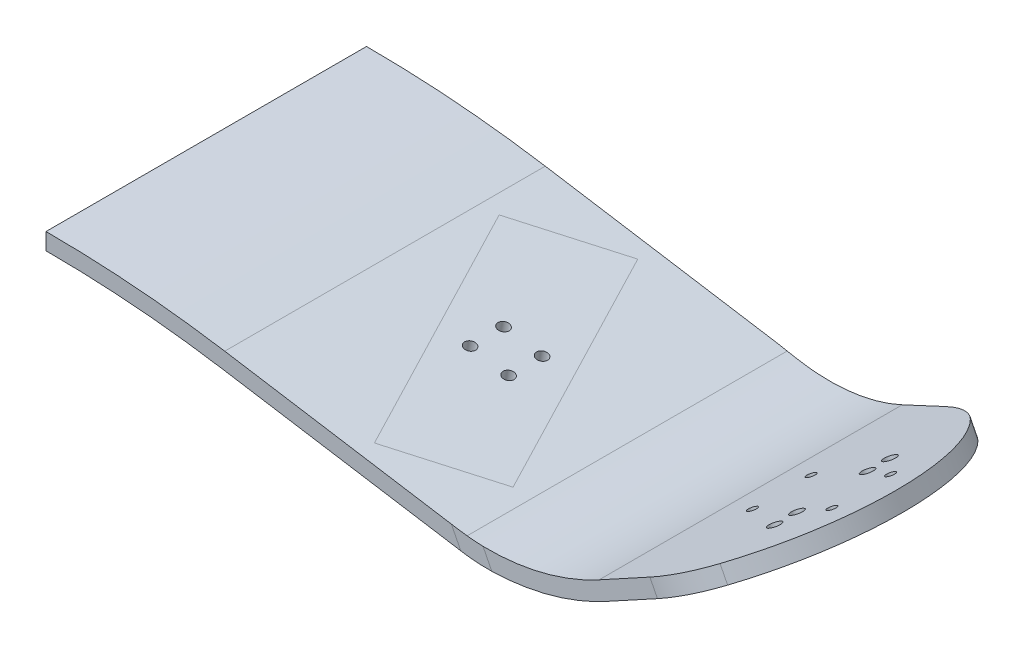
from build123d import *

# Parameters (mm, degrees)
EXTRUDE_THIN1_DEPTH  = 115
CUT_EXTRUDE1_DEPTH   = 620.892995583
FILLET1_R            = 250
SKETCH3_R            = 4
BINDING_HOLES_DEPTH  = 527.107084161
SKETCH4_R            = 4
CUT_EXTRUDE2_DEPTH   = 947.891927405
M6_CLEARANCE_HOLE1_D = 6.6
M8_CLEARANCE_HOLE1_D = 9
SKETCH9_W            = 500
SKETCH9_H            = 230
CUT_EXTRUDE3_DEPTH   = 520.361349661


with BuildPart() as part:
    # Sketch1 → Extrude-Thin1 (new, symmetric)
    with BuildSketch(Plane.XY):
        with BuildLine():
            Line((-500, 70), (-396.134492808, 17.077880761))
            ThreePointArc((-396.134492808, 17.077880761), (-349.336150967, 1.90144375), (-300.138569045, 1.984944587))
            Line((-300.138569045, 1.984944587), (-126.368172253, 29.91072477))
            ThreePointArc((-126.368172253, 29.91072477), (0, 40), (126.368172253, 29.91072477))
            Line((126.368172253, 29.91072477), (300.138569045, 1.984944587))
            ThreePointArc((300.138569045, 1.984944587), (349.336150967, 1.90144375), (396.134492808, 17.077880761))
            Line((396.134492808, 17.077880761), (500, 70))
            Line((500, 70), (494.552114003, 80.69207829))
            Line((494.552114003, 80.69207829), (390.686606812, 27.769959051))
            ThreePointArc((390.686606812, 27.769959051), (347.472349444, 13.755820321), (302.042599512, 13.832926187))
            Line((302.042599512, 13.832926187), (128.27220272, 41.75870637))
            ThreePointArc((128.27220272, 41.75870637), (0, 52), (-128.27220272, 41.75870637))
            Line((-128.27220272, 41.75870637), (-302.042599512, 13.832926187))
            ThreePointArc((-302.042599512, 13.832926187), (-347.472349444, 13.755820321), (-390.686606812, 27.769959051))
            Line((-390.686606812, 27.769959051), (-494.552114003, 80.69207829))
            Line((-494.552114003, 80.69207829), (-500, 70))
        make_face()
    extrude(amount=EXTRUDE_THIN1_DEPTH, both=True)

    # Sketch2 → Cut-Extrude1 (cut, symmetric)
    with BuildSketch(Plane(origin=(-69.290206127, -135.989686473, 0), x_dir=(-0.8910065241883677, 0.4539904997395473, 0), z_dir=(0.45399049973954725, 0.8910065241883676, 0))):
        with BuildLine():
            Line((-1243.954382633, 226.09395148), (275.40194382, 115))
            Line((275.40194382, 115), (398.488815391, 106))
            ThreePointArc((398.488815391, 106), (418.996120575, 101.069384919), (436.845066451, 89.8321405))
            ThreePointArc((436.845066451, 89.8321405), (477.282597076, 0), (436.845066451, -89.8321405))
            ThreePointArc((436.845066451, -89.8321405), (418.996120575, -101.069384919), (398.488815391, -106))
            Line((398.488815391, -106), (275.40194382, -115))
            Line((275.40194382, -115), (-1243.954382633, -226.09395148))
            Line((-1243.954382633, -226.09395148), (1802.870530478, -226.09395148))
            Line((1802.870530478, -226.09395148), (1802.870530478, 226.09395148))
            Line((1802.870530478, 226.09395148), (-1243.954382633, 226.09395148))
        make_face()
    cut_extrude1 = extrude(amount=CUT_EXTRUDE1_DEPTH, both=True, mode=Mode.SUBTRACT)

    # Mirror1: Cut-Extrude1 across plane
    add(cut_extrude1.mirror(Plane(origin=(0, 0, 0), x_dir=(0, 0, 1), z_dir=(1, 0, 0))), mode=Mode.SUBTRACT)

    # Fillet1
    # the kernel refuses this fillet: 250 mm, written as the material it takes off along each edge
    with BuildSketch(Plane(origin=(-319.014996724, -19.477278886, 115), x_dir=(-0.8886341933277065, 0.4527817367914195, -0.07292440796442752), z_dir=(0.45399049973954736, 0.8910065241883677, 0))) as fillet1_piece_1:
        with BuildLine():
            CenterArc((FILLET1_R * 0.0365108095299, -FILLET1_R), FILLET1_R, 90, 4.181973001)
            Line((-FILLET1_R * 0.0364135984345, -FILLET1_R * 0.00266252916927), (-FILLET1_R * 0.0378720865938, FILLET1_R * 0.0172842202473))
            Line((-FILLET1_R * 0.0378720865938, FILLET1_R * 0.0172842202473), (-FILLET1_R * 0.000730216190598, FILLET1_R * 0.02))
            Line((-FILLET1_R * 0.000730216190598, FILLET1_R * 0.02), (FILLET1_R * 0.0365108095299, FILLET1_R * 0.02))
            Line((FILLET1_R * 0.0365108095299, FILLET1_R * 0.02), (FILLET1_R * 0.0365108095299, 0))
        make_face()
    extrude(amount=60.204173091, mode=Mode.SUBTRACT)
    # the kernel refuses this fillet: 250 mm, written as the material it takes off along each edge
    with BuildSketch(Plane(origin=(319.014996724, -19.477278886, 115), x_dir=(-0.8910065241883677, -0.4539904997395473, 0), z_dir=(-0.45399049973954736, 0.8910065241883677, 0))) as fillet1_2_piece_1:
        with BuildLine():
            CenterArc((FILLET1_R * 0.0365108095299, -FILLET1_R), FILLET1_R, 90, 4.181973001)
            Line((-FILLET1_R * 0.0364135984345, -FILLET1_R * 0.00266252916927), (-FILLET1_R * 0.0378720865938, FILLET1_R * 0.0172842202473))
            Line((-FILLET1_R * 0.0378720865938, FILLET1_R * 0.0172842202473), (-FILLET1_R * 0.000730216190598, FILLET1_R * 0.02))
            Line((-FILLET1_R * 0.000730216190598, FILLET1_R * 0.02), (FILLET1_R * 0.0365108095299, FILLET1_R * 0.02))
            Line((FILLET1_R * 0.0365108095299, FILLET1_R * 0.02), (FILLET1_R * 0.0365108095299, 0))
        make_face()
    extrude(amount=60.204173091, mode=Mode.SUBTRACT)
    # the kernel refuses this fillet: 250 mm, written as the material it takes off along each edge
    with BuildSketch(Plane(origin=(-319.014996724, -19.477278886, -115), x_dir=(0.8910065241883677, -0.4539904997395473, 0), z_dir=(0.4539904997395473, 0.8910065241883677, 0))) as fillet1_3_piece_1:
        with BuildLine():
            CenterArc((FILLET1_R * 0.0365108095299, -FILLET1_R), FILLET1_R, 90, 4.181973001)
            Line((-FILLET1_R * 0.0364135984345, -FILLET1_R * 0.00266252916927), (-FILLET1_R * 0.0378720865938, FILLET1_R * 0.0172842202473))
            Line((-FILLET1_R * 0.0378720865938, FILLET1_R * 0.0172842202473), (-FILLET1_R * 0.000730216190598, FILLET1_R * 0.02))
            Line((-FILLET1_R * 0.000730216190598, FILLET1_R * 0.02), (FILLET1_R * 0.0365108095299, FILLET1_R * 0.02))
            Line((FILLET1_R * 0.0365108095299, FILLET1_R * 0.02), (FILLET1_R * 0.0365108095299, 0))
        make_face()
    extrude(amount=60.204173091, mode=Mode.SUBTRACT)
    # the kernel refuses this fillet: 250 mm, written as the material it takes off along each edge
    with BuildSketch(Plane(origin=(319.014996724, -19.477278886, -115), x_dir=(-0.8910065241883677, -0.4539904997395473, 0), z_dir=(-0.4539904997395473, 0.8910065241883677, 0))) as fillet1_4_piece_1:
        with BuildLine():
            CenterArc((FILLET1_R * 0.0365108095299, FILLET1_R), FILLET1_R, 265.818026999, 4.181973001)
            Line((-FILLET1_R * 0.0364135984345, FILLET1_R * 0.00266252916927), (-FILLET1_R * 0.0378720865938, -FILLET1_R * 0.0172842202473))
            Line((-FILLET1_R * 0.0378720865938, -FILLET1_R * 0.0172842202473), (-FILLET1_R * 0.000730216190598, -FILLET1_R * 0.02))
            Line((-FILLET1_R * 0.000730216190598, -FILLET1_R * 0.02), (FILLET1_R * 0.0365108095299, -FILLET1_R * 0.02))
            Line((FILLET1_R * 0.0365108095299, -FILLET1_R * 0.02), (FILLET1_R * 0.0365108095299, 0))
        make_face()
    extrude(amount=60.204173091, mode=Mode.SUBTRACT)

    # Sketch3 → Binding Holes (cut, through all)
    with BuildSketch(Plane(origin=(-9.771253847, 60.8024072, 0), x_dir=(-0.9873317999532861, -0.15866920558509276, 0), z_dir=(-0.15866920558509276, 0.9873317999532861, 0))):
        with Locations((222.02140403, 12)):
            Circle(SKETCH3_R)
        with Locations(Location((222.02140403, -12, 0), (0, 0, 180))):
            Circle(SKETCH3_R)
        with Locations((194.02140403, -12)):
            Circle(SKETCH3_R)
        with Locations(Location((194.02140403, 12, 0), (0, 0, 180))):
            Circle(SKETCH3_R)
    extrude(amount=-BINDING_HOLES_DEPTH, mode=Mode.SUBTRACT)

    # Sketch4 → Cut-Extrude2 (cut, through all)
    with BuildSketch(Plane(origin=(430.771006706, -6.854378838, -35.350500744), x_dir=(-0.9873317999532861, 0.15866920558509276, 0), z_dir=(0.15866920558509276, 0.9873317999532861, 0))):
        with Locations((232.380088234, 47.350500744)):
            Circle(SKETCH4_R)
        with Locations(Location((232.380088234, 23.350500744, 0), (0, 0, 180))):
            Circle(SKETCH4_R)
        with Locations((204.380088234, 23.350500744)):
            Circle(SKETCH4_R)
        with Locations(Location((204.380088234, 47.350500744, 0), (0, 0, 180))):
            Circle(SKETCH4_R)
    extrude(amount=-CUT_EXTRUDE2_DEPTH, mode=Mode.SUBTRACT)

    # M6 Clearance Hole1 (through all)
    with Locations(Plane(origin=(-49.331097603, -146.159360215, -63.345400331), x_dir=(-0.8910065241883677, 0.4539904997395473, 0), z_dir=(0.45399049973954725, 0.8910065241883676, 0))):
        with Locations((472.112244346, 84.345400331), (408.112244346, 84.345400331), (408.112244346, 42.345400331), (472.112244346, 42.345400331)):
            m6_clearance_hole1 = Hole(M6_CLEARANCE_HOLE1_D / 2)

    # M8 Clearance Hole1 (through all)
    with Locations(Plane(origin=(-70.616279149, -135.31401852, -54.210944478), x_dir=(-0.8910065241883677, 0.4539904997395473, 0), z_dir=(0.45399049973954725, 0.8910065241883676, 0))):
        with Locations((424.936326624, 95.560944478), (424.936326624, 79.560944478), (424.936326624, 12.860944478), (424.936326624, 28.860944478)):
            m8_clearance_hole1 = Hole(M8_CLEARANCE_HOLE1_D / 2)

    # Mirror2: M6 Clearance Hole1, M8 Clearance Hole1 across plane
    add(m6_clearance_hole1.mirror(Plane(origin=(0, 0, 0), x_dir=(0, 0, 1), z_dir=(1, 0, 0))), mode=Mode.SUBTRACT)
    add(m8_clearance_hole1.mirror(Plane(origin=(0, 0, 0), x_dir=(0, 0, 1), z_dir=(1, 0, 0))), mode=Mode.SUBTRACT)

    # Sketch9 → Cut-Extrude3 (cut, through all)
    with BuildSketch(Plane(origin=(0, 0, 0), x_dir=(1, 0, 0), z_dir=(0, 1, 0))):
        with Locations((-250, 0)):
            Rectangle(SKETCH9_W, SKETCH9_H)
    extrude(amount=CUT_EXTRUDE3_DEPTH, mode=Mode.SUBTRACT)


solid = part.part
